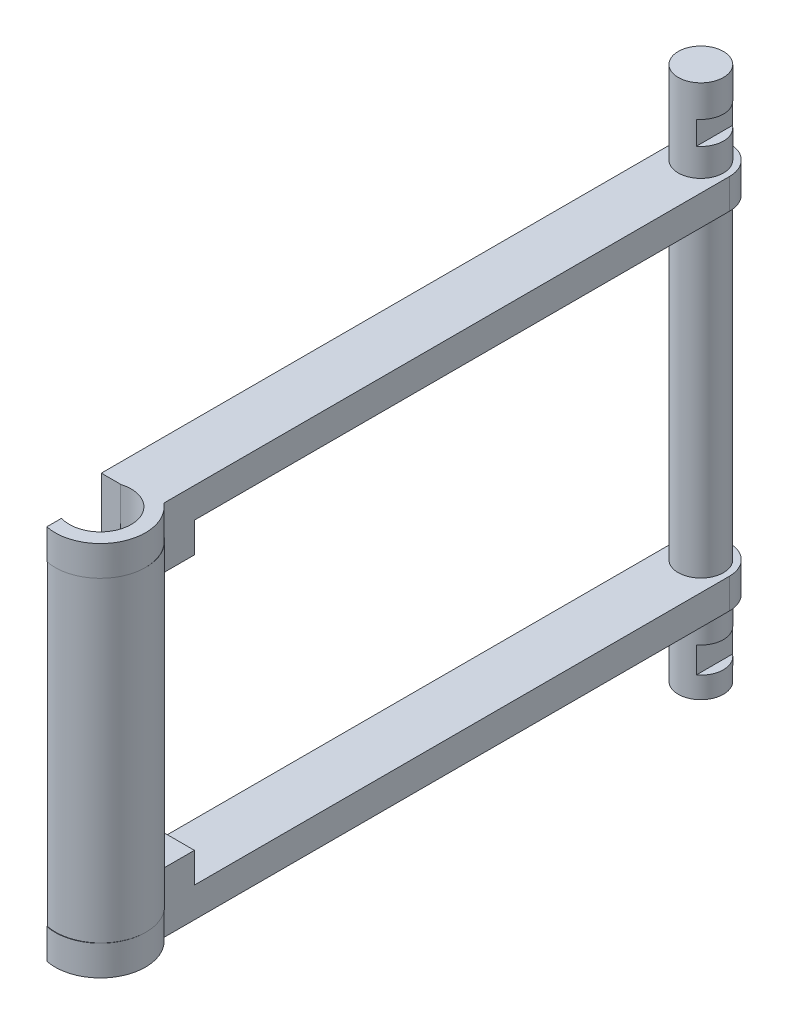
from build123d import *

# Parameters (mm, degrees)
EXTRUDE_1_DEPTH     = 2
SKETCH_2_R          = 3
EXTRUDE_2_DEPTH     = 10.5
SKETCH_3_R          = 2.05
CUT_EXTRUDE_1_DEPTH = 12.5
EXTRUDE_3_DEPTH     = 2
SKETCH_5_R          = 3
SKETCH_5_R_2        = 2.05
EXTRUDE_4_DEPTH     = 2
SKETCH_8_W          = 2.95616439
SKETCH_8_H          = 6.387063899
CUT_EXTRUDE_3_DEPTH = 12.5
SKETCH_9_W          = 1.27668382
SKETCH_9_H          = 4
EXTRUDE_5_DEPTH     = 1
SKETCH_10_R         = 1.5
EXTRUDE_6_DEPTH     = 10.5
MIRROR_START        = 23
MIRROR_11_DEPTH     = 2
SKETCH_11_R         = 1.5
EXTRUDE_7_DEPTH     = 18
EXTRUDE_START       = 5
SKETCH_12_R         = 1.5
EXTRUDE_8_DEPTH     = 5
SKETCH_13_W         = 5.222026014
SKETCH_13_H         = 1.730667712
SKETCH_13_H_2       = 1.553374839
CUT_EXTRUDE_4_DEPTH = 1


# Read off the part's stored shape, not the designer's step: 镜向11
with BuildPart() as part:
    # 草图1 → 凸台-拉伸1 (new body)
    with BuildSketch(Plane(origin=(0, 0, 0), x_dir=(1, 0, 0), z_dir=(0, 1, 0))):
        with BuildLine():
            Line((1.9, 0), (1.9, -40.018240839))
            ThreePointArc((1.9, -40.018240839), (0, -41.918240839), (-1.9, -40.018240839))
            Line((-1.9, -40.018240839), (-1.9, 0))
            ThreePointArc((-1.9, 0), (0, 1.9), (1.9, 0))
        make_face()
    extrude(amount=EXTRUDE_1_DEPTH)

    # 草图2 → 凸台-拉伸2 (add)
    with BuildSketch(Plane(origin=(0, 2, 0), x_dir=(1, 0, 0), z_dir=(0, 1, 0))):
        with Locations(Location((0, -39.871991717, 0), (0, 0, 129.296480239))):
            Circle(SKETCH_2_R)
    extrude_2 = extrude(amount=EXTRUDE_2_DEPTH)

    # 草图3 → 切除-拉伸1 (cut)
    with BuildSketch(Plane(origin=(0, 12.5, 0), x_dir=(1, 0, 0), z_dir=(0, 1, 0))):
        with Locations(Location((0, -39.903679128, 0), (0, 0, 270))):
            Circle(SKETCH_3_R)
    cut_extrude_1 = extrude(amount=-CUT_EXTRUDE_1_DEPTH, mode=Mode.SUBTRACT)

    # 草图4 → 凸台-拉伸3 (add)
    with BuildSketch(Plane(origin=(0, 2, 0), x_dir=(1, 0, 0), z_dir=(0, 1, 0))):
        with BuildLine():
            Line((-1.9, -35.550354364), (-1.9, -37.550354364))
            ThreePointArc((-1.9, -37.550354364), (-1.008733845, -37.046667659), (0, -36.871991717))
            ThreePointArc((0, -36.871991717), (1.008733845, -37.046667659), (1.9, -37.550354364))
            Line((1.9, -37.550354364), (1.9, -35.550354364))
            Line((1.9, -35.550354364), (-1.9, -35.550354364))
        make_face()
    extrude_3 = extrude(amount=EXTRUDE_3_DEPTH)

    # 草图5 → 凸台-拉伸4 (add)
    with BuildSketch(Plane.XZ.offset(-2)):
        with Locations((0, 39.903679128)):
            Circle(SKETCH_5_R)
        with Locations(Location((0, 39.903679128, 0), (0, 0, 90))):
            Circle(SKETCH_5_R_2, mode=Mode.SUBTRACT)
    extrude_4 = extrude(amount=EXTRUDE_4_DEPTH)

    # 草图8 → 切除-拉伸3 (cut)
    with BuildSketch(Plane(origin=(0, 12.5, 0), x_dir=(1, 0, 0), z_dir=(0, 1, 0))):
        with Locations((-2.101398375, -40.130991858)):
            Rectangle(SKETCH_8_W, SKETCH_8_H)
    cut_extrude_3 = extrude(amount=-CUT_EXTRUDE_3_DEPTH, mode=Mode.SUBTRACT)

    # 草图9 → 凸台-拉伸5 (add)
    with BuildSketch(Plane.XY.offset(36.937459908)):
        with Locations((-1.26165809, 2)):
            Rectangle(SKETCH_9_W, SKETCH_9_H)
    extrude_5 = extrude(amount=EXTRUDE_5_DEPTH)

    # 草图10 → 凸台-拉伸6 (add)
    with BuildSketch(Plane(origin=(0, 2, 0), x_dir=(1, 0, 0), z_dir=(0, 1, 0))):
        with Locations(Location((0, 0, 0), (0, 0, 90))):
            Circle(SKETCH_10_R)
    extrude(amount=EXTRUDE_6_DEPTH)

    # 镜向10: 凸台-拉伸2, 切除-拉伸1, 凸台-拉伸3, 凸台-拉伸4, 切除-拉伸3, 凸台-拉伸5 across plane
    add(extrude_2.mirror(Plane.ZX.offset(12.5)))
    add(cut_extrude_1.mirror(Plane.ZX.offset(12.5)), mode=Mode.SUBTRACT)
    add(extrude_3.mirror(Plane.ZX.offset(12.5)))
    add(extrude_4.mirror(Plane.ZX.offset(12.5)))
    add(cut_extrude_3.mirror(Plane.ZX.offset(12.5)), mode=Mode.SUBTRACT)
    add(extrude_5.mirror(Plane.ZX.offset(12.5)))

    # 镜向11 outline → 镜向11 (add)
    with BuildSketch(Plane(origin=(0, 0, 0), x_dir=(1, 0, 0), z_dir=(0, 1, 0)).offset(MIRROR_START)):
        with BuildLine():
            ThreePointArc((1.9, 0), (0, 1.9), (-1.9, 0))
            Line((-1.9, 0), (-1.9, -36.937459908))
            Line((-1.9, -36.937459908), (-0.62331618, -36.937459908))
            Line((-0.62331618, -36.937459908), (-0.62331618, -36.969147319))
            ThreePointArc((-0.62331618, -36.969147319), (0.708089188, -36.988441625), (1.9, -37.582041775))
            Line((1.9, -37.582041775), (1.9, 0))
        make_face()
    extrude(amount=MIRROR_11_DEPTH)

    # 草图11 → 凸台-拉伸7 (add)
    with BuildSketch(Plane(origin=(0, 12.5, 0), x_dir=(1, 0, 0), z_dir=(0, 1, 0))):
        with Locations(Location((0, 0, 0), (0, 0, 90))):
            Circle(SKETCH_11_R)
    extrude(amount=EXTRUDE_7_DEPTH)

    # 草图12 → 凸台-拉伸8 (add)
    with BuildSketch(Plane.XZ.offset(EXTRUDE_START)):
        with Locations(Location((0, 0, 0), (0, 0, 270))):
            Circle(SKETCH_12_R)
    extrude(amount=-EXTRUDE_8_DEPTH)

    # 草图13 → 切除-拉伸4 (cut)
    with BuildSketch(Plane(origin=(1.9, 0, 0), x_dir=(0, 0, -1), z_dir=(1, 0, 0))):
        with Locations((0.263368909, -2.718253364)):
            Rectangle(SKETCH_13_W, SKETCH_13_H)
        with Locations((0.263368909, 27.61617656)):
            Rectangle(SKETCH_13_W, SKETCH_13_H_2)
    extrude(amount=-CUT_EXTRUDE_4_DEPTH, mode=Mode.SUBTRACT)


solid = part.part
